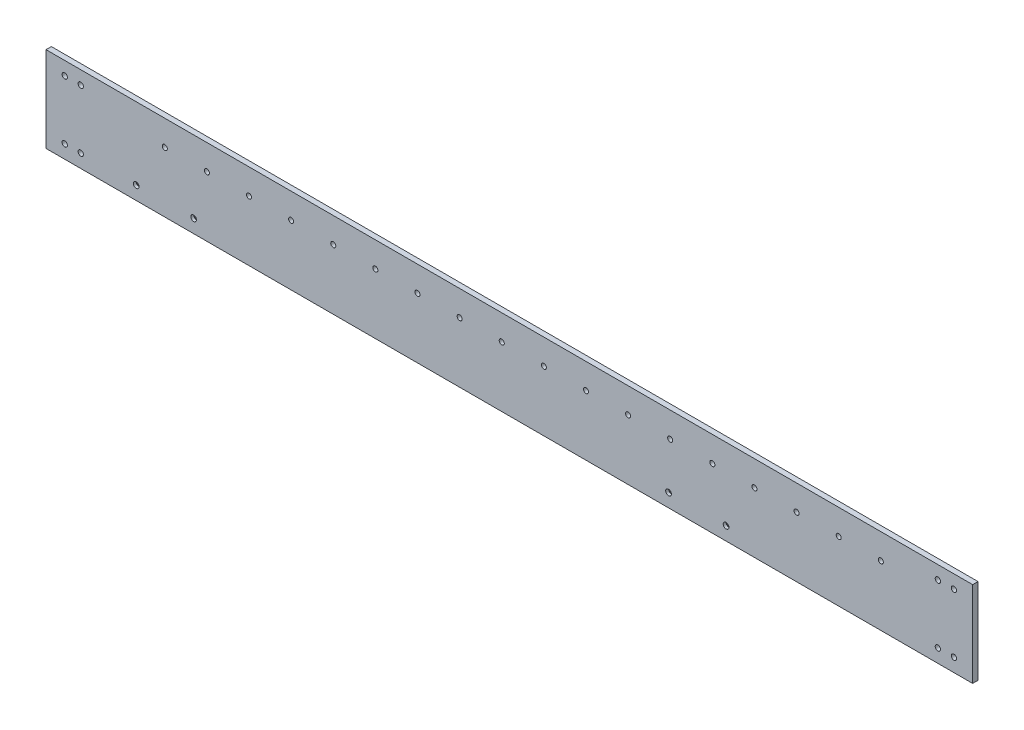
from build123d import *

# Parameters (mm, degrees)
SKETCH1_W                                       = 3.175
SKETCH1_H                                       = 50.8
BOSS_EXTRUDE1_DEPTH                             = 550
LEFTSIDEHOLES_SKETCH4_R                         = 1.5875
LEFTSIDEHOLES_SKETCH4_R_2                       = 1.5
LEFTSIDEHOLES_CUT_EXTRUDE3_DEPTH                = 553.350179347
CSK_FOR_M3_FLAT_HEAD_MACHINE_SCREW1_D           = 3.4
CSK_FOR_M3_FLAT_HEAD_MACHINE_SCREW1_CSINK_D     = 6.3
CSK_FOR_M3_FLAT_HEAD_MACHINE_SCREW1_CSINK_ANGLE = 90


with BuildPart() as part:
    # Sketch1 → Boss-Extrude1 (new body)
    with BuildSketch(Plane(origin=(0, 0, 0), x_dir=(0, 0, -1), z_dir=(1, 0, 0))):
        with Locations((-1.5875, 25.4)):
            Rectangle(SKETCH1_W, SKETCH1_H)
    extrude(amount=BOSS_EXTRUDE1_DEPTH)

    # LeftSideHoles-Sketch4 → LeftSideHoles-Cut-Extrude3 (cut, through all)
    with BuildSketch(Plane.XY.offset(3.175)):
        with Locations((11.1125, 42.8625)):
            Circle(LEFTSIDEHOLES_SKETCH4_R)
        with Locations((529.3625, 42.8625)):
            Circle(LEFTSIDEHOLES_SKETCH4_R)
        with Locations((20.6375, 42.8625)):
            Circle(LEFTSIDEHOLES_SKETCH4_R)
        with Locations((538.8875, 42.8625)):
            Circle(LEFTSIDEHOLES_SKETCH4_R)
        with Locations((11.1125, 7.9375)):
            Circle(LEFTSIDEHOLES_SKETCH4_R)
        with Locations((20.6375, 7.9375)):
            Circle(LEFTSIDEHOLES_SKETCH4_R)
        with Locations((529.3625, 7.9375)):
            Circle(LEFTSIDEHOLES_SKETCH4_R)
        with Locations((538.8875, 7.9375)):
            Circle(LEFTSIDEHOLES_SKETCH4_R)
        with Locations((495.5, 35.8)):
            Circle(LEFTSIDEHOLES_SKETCH4_R_2)
        with Locations((470.5, 35.8)):
            Circle(LEFTSIDEHOLES_SKETCH4_R_2)
        with Locations((445.5, 35.8)):
            Circle(LEFTSIDEHOLES_SKETCH4_R_2)
        with Locations((420.5, 35.8)):
            Circle(LEFTSIDEHOLES_SKETCH4_R_2)
        with Locations((395.5, 35.8)):
            Circle(LEFTSIDEHOLES_SKETCH4_R_2)
        with Locations((370.5, 35.8)):
            Circle(LEFTSIDEHOLES_SKETCH4_R_2)
        with Locations((345.5, 35.8)):
            Circle(LEFTSIDEHOLES_SKETCH4_R_2)
        with Locations((320.5, 35.8)):
            Circle(LEFTSIDEHOLES_SKETCH4_R_2)
        with Locations((295.5, 35.8)):
            Circle(LEFTSIDEHOLES_SKETCH4_R_2)
        with Locations((270.5, 35.8)):
            Circle(LEFTSIDEHOLES_SKETCH4_R_2)
        with Locations((245.5, 35.8)):
            Circle(LEFTSIDEHOLES_SKETCH4_R_2)
        with Locations((220.5, 35.8)):
            Circle(LEFTSIDEHOLES_SKETCH4_R_2)
        with Locations((195.5, 35.8)):
            Circle(LEFTSIDEHOLES_SKETCH4_R_2)
        with Locations((170.5, 35.8)):
            Circle(LEFTSIDEHOLES_SKETCH4_R_2)
        with Locations((145.5, 35.8)):
            Circle(LEFTSIDEHOLES_SKETCH4_R_2)
        with Locations((120.5, 35.8)):
            Circle(LEFTSIDEHOLES_SKETCH4_R_2)
        with Locations((95.5, 35.8)):
            Circle(LEFTSIDEHOLES_SKETCH4_R_2)
        with Locations((70.5, 35.8)):
            Circle(LEFTSIDEHOLES_SKETCH4_R_2)
        with Locations((53.5125, 7.9375)):
            Circle(LEFTSIDEHOLES_SKETCH4_R)
        with Locations((369.5125, 7.9375)):
            Circle(LEFTSIDEHOLES_SKETCH4_R)
        with Locations((87.6375, 7.9375)):
            Circle(LEFTSIDEHOLES_SKETCH4_R)
        with Locations((403.6375, 7.9375)):
            Circle(LEFTSIDEHOLES_SKETCH4_R)
    extrude(amount=-LEFTSIDEHOLES_CUT_EXTRUDE3_DEPTH, mode=Mode.SUBTRACT)

    # CSK for M3 Flat Head Machine Screw1 (through all)
    with Locations(Plane(origin=(0, 0, 0), x_dir=(-1, 0, 0), z_dir=(0, 0, -1))):
        with Locations((-403.6375, 7.9375), (-369.5125, 7.9375), (-87.6375, 7.9375), (-53.5125, 7.9375)):
            CounterSinkHole(CSK_FOR_M3_FLAT_HEAD_MACHINE_SCREW1_D / 2, CSK_FOR_M3_FLAT_HEAD_MACHINE_SCREW1_CSINK_D / 2, counter_sink_angle=CSK_FOR_M3_FLAT_HEAD_MACHINE_SCREW1_CSINK_ANGLE)


solid = part.part
